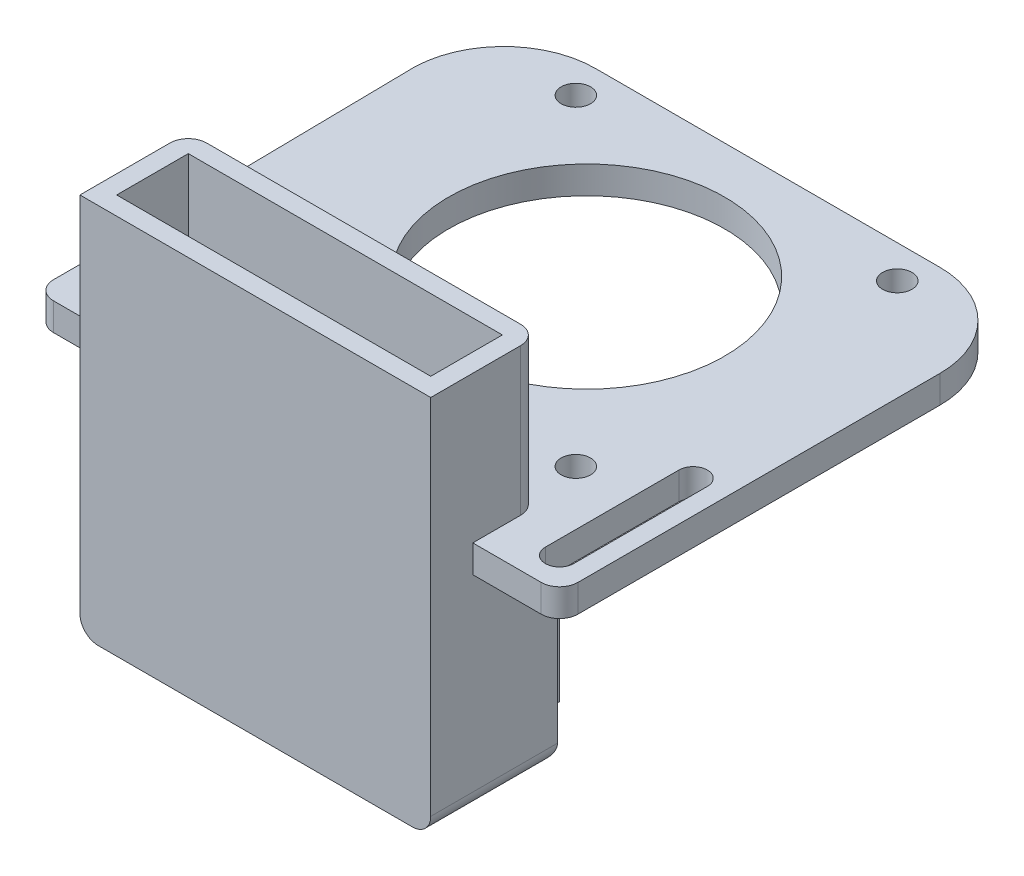
from build123d import *

# Parameters (mm, degrees)
CROQUIS1_R                    = 1.6
SALIENTE_EXTRUIR1_DEPTH       = 3
SALIENTE_EXTRUIR2_DEPTH       = 40
SALIENTE_EXTRUIR2_DEPTH_BACK  = 6
CROQUIS2_W                    = 38.2
CROQUIS2_H                    = 16.8
CROQUIS3_W                    = 34.2
CROQUIS3_H                    = 12.8
CORTAR_EXTRUIR1_DEPTH         = 40
CROQUIS5_W                    = 23.5
CROQUIS5_H                    = 14.7
CORTAR_EXTRUIR2_DEPTH         = 2
CROQUIS7_W                    = 25.5
CROQUIS7_H                    = 16.7
CROQUIS7_W_2                  = 23.5
CROQUIS7_H_2                  = 14.7
SALIENTE_EXTRUIR11_DEPTH      = 1.5
CROQUIS8_W                    = 38.2
CROQUIS8_H                    = 16.8
CORTAR_EXTRUIR8_DEPTH         = 19.5
CROQUIS9_W                    = 38.2
CROQUIS9_H                    = 16.8
SALIENTE_EXTRUIR12_DEPTH      = 2
CROQUIS11_W                   = 38.2
CROQUIS11_H                   = 16.8
SALIENTE_EXTRUIR13_DEPTH      = 13
CROQUIS12_W                   = 34.2
CROQUIS12_H                   = 12.8
CORTAR_EXTRUIR9_DEPTH         = 25
CROQUIS13_W                   = 5.5
CROQUIS13_H                   = 5
SALIENTE_EXTRUIR14_DEPTH      = 15
SALIENTE_EXTRUIR15_DEPTH      = 10
SALIENTE_EXTRUIR15_DEPTH_BACK = 14
CROQUIS14_W                   = 3.5
CROQUIS14_H                   = 12.8
CROQUIS16_W                   = 12.8
CROQUIS16_H                   = 24
SALIENTE_EXTRUIR16_DEPTH      = 2.5
CORTAR_EXTRUIR12_DEPTH        = 3
CROQUIS20_W                   = 7.565862741
CROQUIS20_H                   = 3.217792011
CORTAR_EXTRUIR13_DEPTH        = 0.5
CROQUIS22_W                   = 6
CROQUIS22_H                   = 12.8
CORTAR_EXTRUIR14_DEPTH        = 27
CROQUIS23_W                   = 34.2
CROQUIS23_H                   = 3
SALIENTE_EXTRUIR17_DEPTH      = 40
REDONDEO3_R                   = 10
CROQUIS24_W                   = 34.2
CROQUIS24_H                   = 2
SALIENTE_EXTRUIR18_DEPTH      = 21
CROQUIS25_W                   = 38.2
CROQUIS25_H                   = 16
CORTAR_EXTRUIR15_DEPTH        = 2
CROQUIS26_W                   = 38.2
CROQUIS26_H                   = 41.5
CORTAR_EXTRUIR16_DEPTH        = 3
REDONDEO4_R                   = 2


with BuildPart() as part:
    # Croquis1 → Saliente-Extruir1 (new body)
    # profile 1 of 2: a face of its own
    with BuildSketch(Plane(origin=(0, 0, 0), x_dir=(1, 0, 0), z_dir=(0, 1, 0))):
        Polygon((-25.184210526, -30.409629763), (0, -30.409629763), (26.365789474, -30.409629763), (28.365789474, -30.409629763), (28.365789474, -12.315808834), (28.365789474, 17.012280702), (28.365789474, 19.012280702), (28.365789474, 21.012280702), (-29.249413206, 21.012280702), (-29.249413206, 19.012280702), (-28.733990356, -15.721221442), (-28.734210526, -26.859629763), (-28.734210526, -30.409629763), align=None)
        with BuildLine():
            ThreePointArc((-23.634210526, -26.859629763), (-25.184210526, -28.409629763), (-26.734210526, -26.859629763))
            Line((-26.734210526, -26.859629763), (-26.734210526, -12.315808834))
            ThreePointArc((-26.734210526, -12.315808834), (-25.184210526, -10.765808834), (-23.634210526, -12.315808834))
            Line((-23.634210526, -12.315808834), (-23.634210526, -26.859629763))
        make_face(mode=Mode.SUBTRACT)
        with Locations(Location((-17.684210526, -17.587719298, 0), (0, 0, 270))):
            Circle(CROQUIS1_R, mode=Mode.SUBTRACT)
        with Locations(Location((17.315789474, -17.587719298, 0), (0, 0, 270))):
            Circle(CROQUIS1_R, mode=Mode.SUBTRACT)
        with BuildLine():
            Line((26.365789474, -12.315808834), (26.365789474, -26.859629763))
            ThreePointArc((26.365789474, -26.859629763), (24.815789474, -28.409629763), (23.265789474, -26.859629763))
            Line((23.265789474, -26.859629763), (23.265789474, -12.315808834))
            ThreePointArc((23.265789474, -12.315808834), (24.815789474, -10.765808834), (26.365789474, -12.315808834))
        make_face(mode=Mode.SUBTRACT)
        with Locations(Location((-17.684210526, 17.412280702, 0), (0, 0, 270))):
            Circle(CROQUIS1_R, mode=Mode.SUBTRACT)
        with BuildLine():
            ThreePointArc((0, -14.11448633), (-15.018728155, 0.904241825), (0, 15.922969981))
            ThreePointArc((0, 15.922969981), (10.619844524, 11.524086349), (15.018728155, 0.904241825))
            ThreePointArc((15.018728155, 0.904241825), (10.619844524, -9.715602698), (0, -14.11448633))
        make_face(mode=Mode.SUBTRACT)
        with Locations(Location((17.315789474, 17.412280702, 0), (0, 0, 270))):
            Circle(CROQUIS1_R, mode=Mode.SUBTRACT)
    # profile 2 of 2: a face of its own
    with BuildSketch(Plane(origin=(0, 0, 0), x_dir=(1, 0, 0), z_dir=(0, 1, 0))):
        Polygon((-25.184210526, -30.409629763), (0, -30.409629763), (26.365789474, -30.409629763), (28.365789474, -30.409629763), (28.365789474, -12.315808834), (28.365789474, 17.012280702), (28.365789474, 19.012280702), (28.365789474, 21.012280702), (-29.249413206, 21.012280702), (-29.249413206, 19.012280702), (-28.733990356, -15.721221442), (-28.734210526, -26.859629763), (-28.734210526, -30.409629763), align=None)
        with BuildLine():
            ThreePointArc((-23.634210526, -26.859629763), (-25.184210526, -28.409629763), (-26.734210526, -26.859629763))
            Line((-26.734210526, -26.859629763), (-26.734210526, -12.315808834))
            ThreePointArc((-26.734210526, -12.315808834), (-25.184210526, -10.765808834), (-23.634210526, -12.315808834))
            Line((-23.634210526, -12.315808834), (-23.634210526, -26.859629763))
        make_face(mode=Mode.SUBTRACT)
        with Locations(Location((-17.684210526, -17.587719298, 0), (0, 0, 270))):
            Circle(CROQUIS1_R, mode=Mode.SUBTRACT)
        with Locations(Location((17.315789474, -17.587719298, 0), (0, 0, 270))):
            Circle(CROQUIS1_R, mode=Mode.SUBTRACT)
        with BuildLine():
            Line((26.365789474, -12.315808834), (26.365789474, -26.859629763))
            ThreePointArc((26.365789474, -26.859629763), (24.815789474, -28.409629763), (23.265789474, -26.859629763))
            Line((23.265789474, -26.859629763), (23.265789474, -12.315808834))
            ThreePointArc((23.265789474, -12.315808834), (24.815789474, -10.765808834), (26.365789474, -12.315808834))
        make_face(mode=Mode.SUBTRACT)
        with Locations(Location((-17.684210526, 17.412280702, 0), (0, 0, 270))):
            Circle(CROQUIS1_R, mode=Mode.SUBTRACT)
        with BuildLine():
            ThreePointArc((0, -14.11448633), (-15.018728155, 0.904241825), (0, 15.922969981))
            ThreePointArc((0, 15.922969981), (10.619844524, 11.524086349), (15.018728155, 0.904241825))
            ThreePointArc((15.018728155, 0.904241825), (10.619844524, -9.715602698), (0, -14.11448633))
        make_face(mode=Mode.SUBTRACT)
        with Locations(Location((17.315789474, 17.412280702, 0), (0, 0, 270))):
            Circle(CROQUIS1_R, mode=Mode.SUBTRACT)
    extrude(amount=SALIENTE_EXTRUIR1_DEPTH)

    # Croquis2 → Saliente-Extruir2 (add, two sides: drawn at the far end of the back side and taken through both)
    with BuildSketch(Plane.XZ.offset(-SALIENTE_EXTRUIR2_DEPTH_BACK)):
        with Locations((-0.184210526, 29.587719298)):
            Rectangle(CROQUIS2_W, CROQUIS2_H)
    extrude(amount=SALIENTE_EXTRUIR2_DEPTH + SALIENTE_EXTRUIR2_DEPTH_BACK)

    # Croquis3 → Cortar-Extruir1 (cut)
    with BuildSketch(Plane.XZ.offset(40)):
        with Locations((-0.184210526, 29.587719298)):
            Rectangle(CROQUIS3_W, CROQUIS3_H)
    extrude(amount=-CORTAR_EXTRUIR1_DEPTH, mode=Mode.SUBTRACT)

    # Croquis5 → Cortar-Extruir2 (cut)
    with BuildSketch(Plane(origin=(0, 0, 21.187719298), x_dir=(-1, 0, 0), z_dir=(0, 0, -1))):
        with Locations((-4.865789474, -9.65)):
            Rectangle(CROQUIS5_W, CROQUIS5_H)
    extrude(amount=-CORTAR_EXTRUIR2_DEPTH, mode=Mode.SUBTRACT)

    # Croquis7 → Saliente-Extruir11 (add)
    with BuildSketch(Plane(origin=(0, 0, 21.187719298), x_dir=(-1, 0, 0), z_dir=(0, 0, -1))):
        with Locations((-4.865789474, -9.65)):
            Rectangle(CROQUIS7_W, CROQUIS7_H)
        with Locations((-4.865789474, -9.65)):
            Rectangle(CROQUIS7_W_2, CROQUIS7_H_2, mode=Mode.SUBTRACT)
    extrude(amount=SALIENTE_EXTRUIR11_DEPTH)

    # Croquis8 → Cortar-Extruir8 (cut)
    with BuildSketch(Plane.XZ.offset(40)):
        with Locations((-0.184210526, 29.587719298)):
            Rectangle(CROQUIS8_W, CROQUIS8_H)
    extrude(amount=-CORTAR_EXTRUIR8_DEPTH, mode=Mode.SUBTRACT)

    # Croquis9 → Saliente-Extruir12 (add)
    with BuildSketch(Plane.XZ.offset(20.5)):
        with Locations((-0.184210526, 29.587719298)):
            Rectangle(CROQUIS9_W, CROQUIS9_H)
    extrude(amount=SALIENTE_EXTRUIR12_DEPTH)

    # Croquis11 → Saliente-Extruir13 (add)
    with BuildSketch(Plane(origin=(0, 6, 0), x_dir=(1, 0, 0), z_dir=(0, 1, 0))):
        with Locations((-0.184210526, -29.587719298)):
            Rectangle(CROQUIS11_W, CROQUIS11_H)
    extrude(amount=SALIENTE_EXTRUIR13_DEPTH)

    # Croquis12 → Cortar-Extruir9 (cut)
    with BuildSketch(Plane(origin=(0, 19, 0), x_dir=(1, 0, 0), z_dir=(0, 1, 0))):
        with Locations((-0.184210526, -29.587719298)):
            Rectangle(CROQUIS12_W, CROQUIS12_H)
    extrude(amount=-CORTAR_EXTRUIR9_DEPTH, mode=Mode.SUBTRACT)

    # Croquis13 → Saliente-Extruir14 (add)
    with BuildSketch(Plane(origin=(0, 0, 21.187719298), x_dir=(-1, 0, 0), z_dir=(0, 0, -1))):
        with Locations((16.534210526, -2.5)):
            Rectangle(CROQUIS13_W, CROQUIS13_H)
    extrude(amount=-SALIENTE_EXTRUIR14_DEPTH)

    # Croquis14 → Saliente-Extruir15 (add, two sides: drawn at the far end of the back side and taken through both)
    with BuildSketch(Plane(origin=(0, 0, 0), x_dir=(1, 0, 0), z_dir=(0, 1, 0)).offset(-SALIENTE_EXTRUIR15_DEPTH_BACK)):
        with Locations((-15.534210526, -29.587719298)):
            Rectangle(CROQUIS14_W, CROQUIS14_H)
    extrude(amount=SALIENTE_EXTRUIR15_DEPTH + SALIENTE_EXTRUIR15_DEPTH_BACK)

    # Croquis16 → Saliente-Extruir16 (add)
    with BuildSketch(Plane(origin=(-13.784210526, 0, 0), x_dir=(0, 0, -1), z_dir=(1, 0, 0))):
        with Locations((-29.587719298, -2)):
            Rectangle(CROQUIS16_W, CROQUIS16_H)
    extrude(amount=SALIENTE_EXTRUIR16_DEPTH)

    # Croquis19 → Cortar-Extruir12 (cut)
    with BuildSketch(Plane(origin=(0, 3, 0), x_dir=(1, 0, 0), z_dir=(0, 1, 0))):
        with BuildLine():
            Line((28.365789474, 21.012280702), (18.365789474, 21.012280702))
            ThreePointArc((18.365789474, 21.012280702), (25.436857286, 18.083348514), (28.365789474, 11.012280702))
            Line((28.365789474, 11.012280702), (28.365789474, 21.012280702))
        make_face()
        with BuildLine():
            Line((-29.249413206, 21.012280702), (-29.179333075, 14.289695354))
            Line((-29.179333075, 14.289695354), (-29.13663051, 11.412039439))
            ThreePointArc((-29.13663051, 11.412039439), (-26.072914346, 18.223299609), (-19.144624058, 21.012280702))
            Line((-19.144624058, 21.012280702), (-29.249413206, 21.012280702))
        make_face()
        with BuildLine():
            Line((28.365789474, -30.409629763), (28.365789474, -28.409629763))
            ThreePointArc((28.365789474, -28.409629763), (27.780003036, -29.823843325), (26.365789474, -30.409629763))
            Line((26.365789474, -30.409629763), (28.365789474, -30.409629763))
        make_face()
        with BuildLine():
            ThreePointArc((-28.734210526, -28.409629763), (-28.148424089, -29.823843325), (-26.734210526, -30.409629763))
            Line((-26.734210526, -30.409629763), (-28.734210526, -30.409629763))
            Line((-28.734210526, -30.409629763), (-28.734210526, -28.409629763))
        make_face()
    extrude(amount=-CORTAR_EXTRUIR12_DEPTH, mode=Mode.SUBTRACT)


with BuildPart() as cortar_extruir12_piece_1:
    # of the separate pieces the step leaves, piece 1, a body of its own (cortar_extruir12_pieces)
    add(part.part.solids().sort_by_distance((-26.734210526, 0, 30.409629763))[0])

    # Croquis22 → Cortar-Extruir14 (cut)
    with BuildSketch(Plane(origin=(0, 10, 0), x_dir=(1, 0, 0), z_dir=(0, 1, 0))):
        with Locations((-14.284210526, -29.587719298)):
            Rectangle(CROQUIS22_W, CROQUIS22_H)
    extrude(amount=-CORTAR_EXTRUIR14_DEPTH, mode=Mode.SUBTRACT)

    # Croquis23 → Saliente-Extruir17 (add)
    with BuildSketch(Plane(origin=(0, 19, 0), x_dir=(1, 0, 0), z_dir=(0, 1, 0))):
        with Locations((-0.184210526, -34.487719298)):
            Rectangle(CROQUIS23_W, CROQUIS23_H)
    extrude(amount=-SALIENTE_EXTRUIR17_DEPTH)

    # Redondeo3
    # the kernel refuses this fillet: 10 mm, written as the material it adds along each edge
    with BuildSketch(Plane(origin=(16.915789474, -20.5, 32.987719298), x_dir=(0, 1, 0), z_dir=(-1, 0, 0))) as redondeo3_piece_1:
        with BuildLine():
            CenterArc((9.9979998, 10), REDONDEO3_R, 181.145991998, 88.854008002)
            Line((0, 9.8), (-0.199959996, 9.796))
            ThreePointArc((-0.199959996, 9.796), (-0.2, 4.9), (-0.2, 0))
            Line((-0.2, 0), (0, -0.2))
            Line((0, -0.2), (9.9979998, -0.2))
            Line((9.9979998, -0.2), (9.9979998, 0))
        make_face()
    extrude(amount=34.2)

    # Croquis24 → Saliente-Extruir18 (add)
    with BuildSketch(Plane(origin=(0, 19, 0), x_dir=(1, 0, 0), z_dir=(0, 1, 0))):
        with Locations((-0.184210526, -24.187719298)):
            Rectangle(CROQUIS24_W, CROQUIS24_H)
    extrude(amount=-SALIENTE_EXTRUIR18_DEPTH)

    # Croquis25 → Cortar-Extruir15 (cut)
    with BuildSketch(Plane(origin=(0, 0, 21.187719298), x_dir=(-1, 0, 0), z_dir=(0, 0, -1))):
        with Locations((0.184210526, 11)):
            Rectangle(CROQUIS25_W, CROQUIS25_H)
    extrude(amount=-CORTAR_EXTRUIR15_DEPTH, mode=Mode.SUBTRACT)

    # Croquis26 → Cortar-Extruir16 (cut)
    with BuildSketch(Plane.XY.offset(37.987719298)):
        with Locations((-0.184210526, -1.75)):
            Rectangle(CROQUIS26_W, CROQUIS26_H)
    extrude(amount=-CORTAR_EXTRUIR16_DEPTH, mode=Mode.SUBTRACT)

    # Redondeo4
    redondeo4_edges = [cortar_extruir12_piece_1.edges().sort_by_distance(p)[0] for p in [
        (-19.284210526, -11.25, 21.187719298),
        (-19.284210526, -22.5, 28.087719298),
        (-0.184210526, -22.5, 21.187719298),
        (18.915789474, -22.5, 28.087719298),
        (-19.284210526, 11, 23.187719298),
        (18.915789474, 11, 23.187719298),
    ]]
    fillet(redondeo4_edges, radius=REDONDEO4_R)


with BuildPart() as cortar_extruir12_piece_2:
    # of the separate pieces the step leaves, piece 2, a body of its own (cortar_extruir12_pieces)
    add(part.part.solids().sort_by_distance((-29.249413206, 0, -21.012280702))[0])

    # Croquis20 → Cortar-Extruir13 (cut)
    with BuildSketch(Plane(origin=(-28.960905799, 0, 0.42976123), x_dir=(0.014837723757860641, 0, 0.99988991491748), z_dir=(-0.99988991491748, 0, 0.014837723757860641))):
        with Locations((-18.504008527, 1.391103994)):
            Rectangle(CROQUIS20_W, CROQUIS20_H)
    extrude(amount=-CORTAR_EXTRUIR13_DEPTH, mode=Mode.SUBTRACT)


solid = cortar_extruir12_piece_1.part
